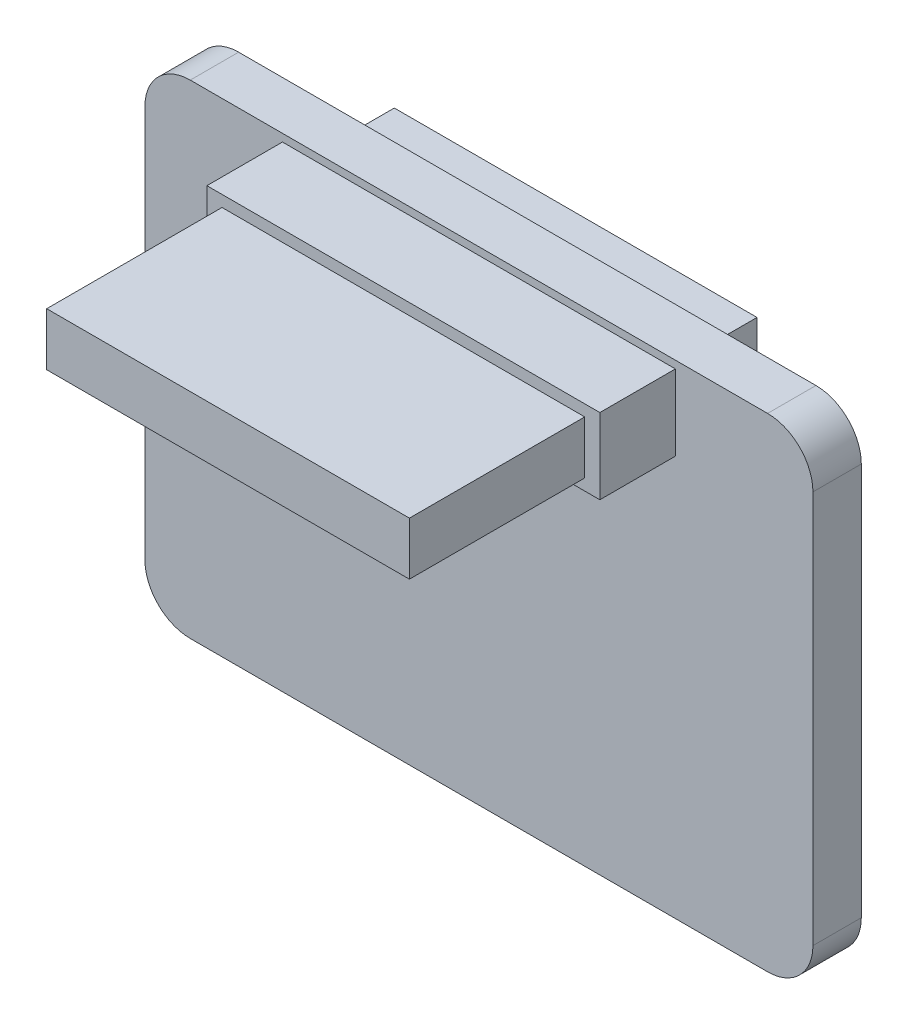
from build123d import *

# Parameters (mm, degrees)
SKETCH1_W                = 22.1
SKETCH1_H                = 16
BOSS_EXTRUDE1_DEPTH      = 1.6
BOSS_EXTRUDE2_DEPTH      = 9.9
BOSS_EXTRUDE2_DEPTH_BACK = 1.6
SKETCH1_3_W              = 12
SKETCH1_3_H              = 1.75
SKETCH1_4_W              = 13
SKETCH1_4_H              = 2.5
BOSS_EXTRUDE3_DEPTH      = 4.1
FILLET1_R                = 1.5


with BuildPart() as part:
    # Sketch1 → Boss-Extrude1 (new body)
    with BuildSketch(Plane.XY):
        Rectangle(SKETCH1_W, SKETCH1_H)
    extrude(amount=BOSS_EXTRUDE1_DEPTH)

    # Fillet1
    fillet1_edges = [part.edges().sort_by_distance(p)[0] for p in [
        (11.05, 8, 0.8),
        (11.05, -8, 0.8),
        (-11.05, 8, 0.8),
        (-11.05, -8, 0.8),
    ]]
    fillet(fillet1_edges, radius=FILLET1_R)


with BuildPart() as body_2:
    # Sketch1<3> → Boss-Extrude2 (new, two sides: drawn at the far end of the back side and taken through both)
    with BuildSketch(Plane.XY.offset(-BOSS_EXTRUDE2_DEPTH_BACK)):
        with Locations((0, 6.5)):
            Rectangle(SKETCH1_3_W, SKETCH1_3_H)
    extrude(amount=BOSS_EXTRUDE2_DEPTH + BOSS_EXTRUDE2_DEPTH_BACK)


with BuildPart() as body_3:
    # Sketch1<4> → Boss-Extrude3 (new body)
    with BuildSketch(Plane.XY):
        with Locations((0, 6.5)):
            Rectangle(SKETCH1_4_W, SKETCH1_4_H)
    extrude(amount=BOSS_EXTRUDE3_DEPTH)


solid = Compound([part.part, body_2.part, body_3.part])
